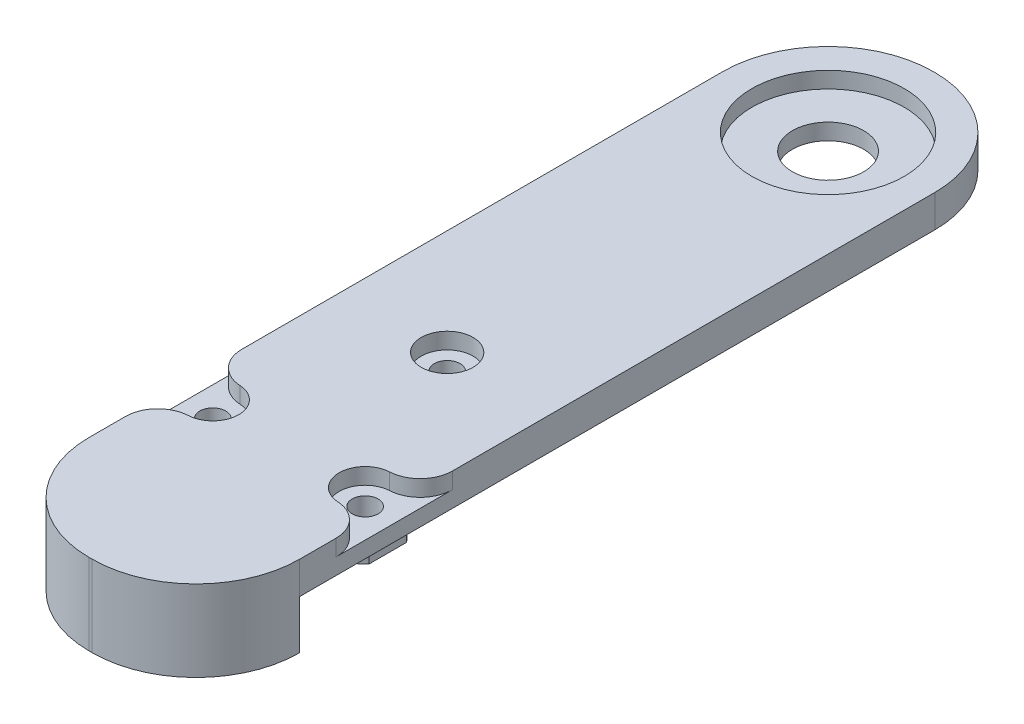
from build123d import *

# Parameters (mm, degrees)
BOSS_EXTRUDE1_DEPTH = 10
SKETCH2_R           = 23.5
CUT_EXTRUDE1_DEPTH  = 5
SKETCH3_R           = 11
CUT_EXTRUDE2_DEPTH  = 135.094183319
SKETCH22_R          = 8
CUT_EXTRUDE15_DEPTH = 4
SKETCH23_R          = 4
BOSS_EXTRUDE6_DEPTH = 4
SKETCH24_R          = 4
CUT_EXTRUDE16_DEPTH = 135.373546504
BOSS_EXTRUDE7_START = 15
BOSS_EXTRUDE7_DEPTH = 15
SKETCH26_R          = 8
CUT_EXTRUDE17_DEPTH = 5
FILLET1_R           = 10
FILLET2_R           = 10


with BuildPart() as part:
    # Sketch1 → Boss-Extrude1 (new body)
    with BuildSketch(Plane(origin=(0, 0, 0), x_dir=(1, 0, 0), z_dir=(0, 1, 0))):
        with BuildLine():
            Line((0, 130), (0.5, 130))
            ThreePointArc((0.5, 130), (23.127416998, 120.627416998), (32.5, 98))
            Line((32.5, 98), (32.5, -98))
            ThreePointArc((32.5, -98), (23.127416998, -120.627416998), (0.5, -130))
            Line((0.5, -130), (-0.5, -130))
            ThreePointArc((-0.5, -130), (-23.127416998, -120.627416998), (-32.5, -98))
            Line((-32.5, -98), (-32.5, 97.5))
            ThreePointArc((-32.5, 97.5), (-22.980970389, 120.480970389), (0, 130))
        make_face()
    extrude(amount=BOSS_EXTRUDE1_DEPTH)

    # Sketch2 → Cut-Extrude1 (cut)
    with BuildSketch(Plane(origin=(0, 10, 0), x_dir=(1, 0, 0), z_dir=(0, 1, 0))):
        with Locations(Location((0, 97.5, 0), (0, 0, 270))):
            Circle(SKETCH2_R)
    extrude(amount=-CUT_EXTRUDE1_DEPTH, mode=Mode.SUBTRACT)

    # Sketch3 → Cut-Extrude2 (cut, through all)
    with BuildSketch(Plane(origin=(0, 5, 0), x_dir=(1, 0, 0), z_dir=(0, 1, 0))):
        with Locations(Location((0, 97.5, 0), (0, 0, 270))):
            Circle(SKETCH3_R)
    extrude(amount=-CUT_EXTRUDE2_DEPTH, mode=Mode.SUBTRACT)

    # Sketch22 → Cut-Extrude15 (cut)
    with BuildSketch(Plane.XZ):
        with Locations(Location((0, 48.75, 0), (0, 0, 270))):
            Circle(SKETCH22_R)
    extrude(amount=-CUT_EXTRUDE15_DEPTH, mode=Mode.SUBTRACT)

    # Sketch23 → Boss-Extrude6 (add)
    # profile 1 of 2: a face of its own
    with BuildSketch(Plane.XZ):
        with BuildLine():
            Line((-30.5, 74.616516124), (-30.5, 62.993052049))
            ThreePointArc((-30.5, 62.993052049), (-14.401855723, 68.804784086), (-30.5, 74.616516124))
        make_face()
        with Locations(Location((-23.5, 68.804784086, 0), (0, 0, 270))):
            Circle(SKETCH23_R, mode=Mode.SUBTRACT)
    # profile 2 of 2: a face of its own
    with BuildSketch(Plane.XZ):
        with BuildLine():
            Line((30.5, 74.616516124), (30.5, 62.993052049))
            ThreePointArc((30.5, 62.993052049), (14.401855723, 68.804784086), (30.5, 74.616516124))
        make_face()
        with Locations(Location((23.5, 68.804784086, 0), (0, 0, 90))):
            Circle(SKETCH23_R, mode=Mode.SUBTRACT)
    extrude(amount=BOSS_EXTRUDE6_DEPTH)

    # Sketch24 → Cut-Extrude16 (cut, through all)
    with BuildSketch(Plane.XZ):
        with Locations(Location((0, 20, 0), (0, 0, 270))):
            Circle(SKETCH24_R)
        with Locations(Location((-23.5, 68.804784086, 0), (0, 0, 270))):
            Circle(SKETCH24_R)
        with Locations(Location((23.5, 68.804784086, 0), (0, 0, 90))):
            Circle(SKETCH24_R)
    extrude(amount=-CUT_EXTRUDE16_DEPTH, mode=Mode.SUBTRACT)

    # Sketch25 → Boss-Extrude7 (add)
    with BuildSketch(Plane.XZ.offset(BOSS_EXTRUDE7_START)):
        with BuildLine():
            Line((-32.5, 98), (-30.5, 98))
            ThreePointArc((-30.5, 98), (-21.713203436, 119.213203436), (-0.5, 128))
            Line((-0.5, 128), (0.5, 128))
            ThreePointArc((0.5, 128), (21.713203436, 119.213203436), (30.5, 98))
            Line((30.5, 98), (32.5, 98))
            ThreePointArc((32.5, 98), (23.127416998, 120.627416998), (0.5, 130))
            Line((0.5, 130), (-0.5, 130))
            ThreePointArc((-0.5, 130), (-23.127416998, 120.627416998), (-32.5, 98))
        make_face()
    extrude(amount=-BOSS_EXTRUDE7_DEPTH)

    # Sketch26 → Cut-Extrude17 (cut)
    with BuildSketch(Plane(origin=(0, 10, 0), x_dir=(1, 0, 0), z_dir=(0, 1, 0))):
        with Locations(Location((0, -20, 0), (0, 0, 270))):
            Circle(SKETCH26_R)
        with BuildLine():
            Line((-23.5, -60.804784086), (-32.5, -60.804784086))
            Line((-32.5, -60.804784086), (-32.5, -76.804784086))
            Line((-32.5, -76.804784086), (-23.5, -76.804784086))
            ThreePointArc((-23.5, -76.804784086), (-15.5, -68.804784086), (-23.5, -60.804784086))
        make_face()
        with BuildLine():
            Line((23.5, -60.804784086), (32.5, -60.804784086))
            Line((32.5, -60.804784086), (32.5, -76.804784086))
            Line((32.5, -76.804784086), (23.5, -76.804784086))
            ThreePointArc((23.5, -76.804784086), (15.5, -68.804784086), (23.5, -60.804784086))
        make_face()
    extrude(amount=-CUT_EXTRUDE17_DEPTH, mode=Mode.SUBTRACT)

    # Fillet1
    # the kernel refuses this fillet: 10 mm, written as the material it takes off along each edge
    with BuildSketch(Plane(origin=(-32.5, 34.930501889, 76.804784086), x_dir=(0, 0, 1), z_dir=(0, -1, 0))) as fillet1_piece_1:
        with BuildLine():
            CenterArc((9.972200756, -10), FILLET1_R, 90, 86.815261463)
            Line((-0.01235522, -9.444444444), (-1.010810817, -9.388888889))
            ThreePointArc((-1.010810817, -9.388888889), (-1, -9), (-1, 0))
            Line((-1, 0), (0, 1))
            Line((0, 1), (9.972200756, 1))
            Line((9.972200756, 1), (9.972200756, 0))
        make_face()
    extrude(amount=29.930501889, mode=Mode.SUBTRACT)
    with BuildSketch(Plane(origin=(-32.5, 34.930501889, 60.804784086), x_dir=(0, 0, -1), z_dir=(0, -1, 0))) as fillet1_piece_2:
        with BuildLine():
            CenterArc((9.972200756, 10), FILLET1_R, 183.184738537, 86.815261463)
            Line((-0.01235522, 9.444444444), (-1.010810817, 9.388888889))
            ThreePointArc((-1.010810817, 9.388888889), (-1, 9), (-1, 0))
            Line((-1, 0), (0, -1))
            Line((0, -1), (9.972200756, -1))
            Line((9.972200756, -1), (9.972200756, 0))
        make_face()
    extrude(amount=29.930501889, mode=Mode.SUBTRACT)

    # Fillet2
    # the kernel refuses this fillet: 10 mm, written as the material it takes off along each edge
    with BuildSketch(Plane(origin=(32.5, 34.930501889, 76.804784086), x_dir=(0, 0, 1), z_dir=(0, -1, 0))) as fillet2_piece_1:
        with BuildLine():
            CenterArc((9.972200756, 10), FILLET2_R, 183.184738537, 86.815261463)
            Line((-0.01235522, 9.444444444), (-1.010810817, 9.388888889))
            ThreePointArc((-1.010810817, 9.388888889), (-1, 9), (-1, 0))
            Line((-1, 0), (0, -1))
            Line((0, -1), (9.972200756, -1))
            Line((9.972200756, -1), (9.972200756, 0))
        make_face()
    extrude(amount=29.930501889, mode=Mode.SUBTRACT)
    with BuildSketch(Plane(origin=(32.5, 34.930501889, 60.804784086), x_dir=(0, 0, -1), z_dir=(0, -1, 0))) as fillet2_piece_2:
        with BuildLine():
            CenterArc((9.972200756, -10), FILLET2_R, 90, 86.815261463)
            Line((-0.01235522, -9.444444444), (-1.010810817, -9.388888889))
            ThreePointArc((-1.010810817, -9.388888889), (-1, -9), (-1, 0))
            Line((-1, 0), (0, 1))
            Line((0, 1), (9.972200756, 1))
            Line((9.972200756, 1), (9.972200756, 0))
        make_face()
    extrude(amount=29.930501889, mode=Mode.SUBTRACT)


solid = part.part
